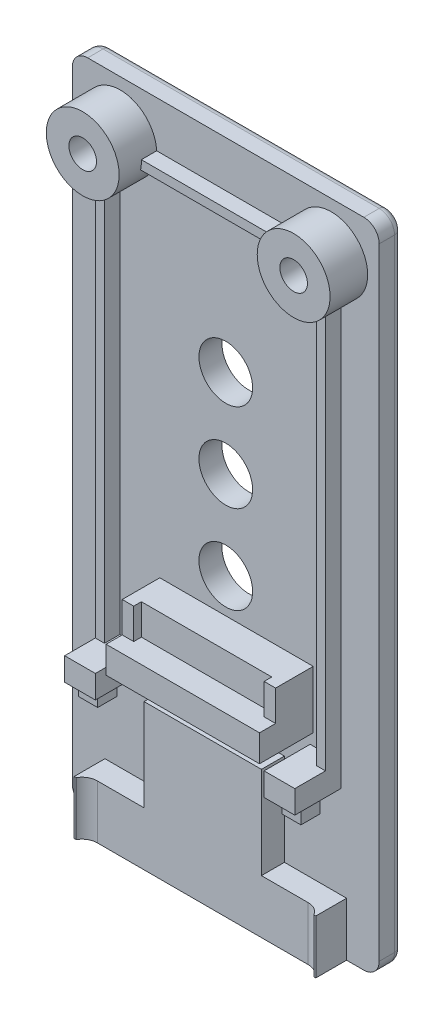
from build123d import *

# Parameters (mm, degrees)
EXTRUDE_1_DEPTH     = 3
SKETCH_4_W          = 31.5
SKETCH_4_H          = 7
EXTRUDE_2_DEPTH     = 3
SKETCH_5_W          = 15.3
SKETCH_5_H          = 12
EXTRUDE_3_DEPTH     = 3
EXTRUDE_3_2_DEPTH   = 2
SKETCH_7_W          = 4
SKETCH_7_H          = 3
EXTRUDE_5_DEPTH     = 6
SKETCH_8_W          = 2.5
SKETCH_8_H          = 2.5
EXTRUDE_6_DEPTH     = 2
EXTRUDE_7_DEPTH     = 7
SKETCH_10_W         = 38.86016461
SKETCH_10_H         = 9.384719245
CUT_EXTRUDE_1_DEPTH = 7
SKETCH_12_W         = 20
SKETCH_12_H         = 4
EXTRUDE_9_DEPTH     = 3.9
SKETCH_13_W         = 1.5
SKETCH_13_H         = 4
EXTRUDE_10_DEPTH    = 1
SKETCH_14_R         = 4.75
EXTRUDE_11_DEPTH    = 4.9
SKETCH_16_R         = 1.8
CUT_EXTRUDE_3_DEPTH = 87.322082101
SKETCH_17_R         = 3.5
CUT_EXTRUDE_4_DEPTH = 4
SKETCH_18_W         = 20
SKETCH_18_H         = 3.5
EXTRUDE_12_DEPTH    = 7
WRAP_START          = -0.4
WRAP_1_OUTLINE_W    = 0.897435898
WRAP_1_OUTLINE_H    = 3.5
WRAP_1_DEPTH        = 0.4
SKETCH_20_R         = 3.5
CUT_EXTRUDE_5_DEPTH = 7
WRAP1_START         = -0.4
WRAP1_DEPTH         = 0.4
FILLET1_R           = 1


# Read off the part's stored shape, not the designer's step: Перенос1, Wrap1
with BuildPart() as part:
    # Эскиз3 → Бобышка-Вытянуть1 (new body)
    with BuildSketch(Plane.XY):
        with BuildLine():
            Line((21.251874208, -81.291354299), (21.251874208, -0.291354299))
            ThreePointArc((21.251874208, -0.291354299), (20.66608777, 1.122859264), (19.251874208, 1.708645701))
            Line((19.251874208, 1.708645701), (-16.748125792, 1.708645701))
            ThreePointArc((-16.748125792, 1.708645701), (-18.162339355, 1.122859264), (-18.748125792, -0.291354299))
            Line((-18.748125792, -0.291354299), (-18.748125792, -81.291354299))
            ThreePointArc((-18.748125792, -81.291354299), (-18.162339355, -82.705567861), (-16.748125792, -83.291354299))
            Line((-16.748125792, -83.291354299), (-14.498125792, -83.291354299))
            Line((-14.498125792, -83.291354299), (19.251874208, -83.291354299))
            ThreePointArc((19.251874208, -83.291354299), (20.66608777, -82.705567861), (21.251874208, -81.291354299))
        make_face()
    extrude(amount=EXTRUDE_1_DEPTH)

    # Эскиз4 → Бобышка-Вытянуть2 (add)
    with BuildSketch(Plane.XY.offset(3)):
        with Locations((1.251874208, -79.791354299)):
            Rectangle(SKETCH_4_W, SKETCH_4_H)
    extrude(amount=EXTRUDE_2_DEPTH)

    # Эскиз5 → Extrude 3 (add)
    with BuildSketch(Plane.XY.offset(3)):
        with Locations((1.251874208, -70.291354299)):
            Rectangle(SKETCH_5_W, SKETCH_5_H)
    extrude(amount=EXTRUDE_3_DEPTH)

    # Эскиз6 → Extrude 3 2 (add)
    with BuildSketch(Plane.XY.offset(3)):
        Polygon((-13.748125792, -64.291354299), (-13.748125792, -4.291354299), (16.251874208, -4.291354299), (16.251874208, -64.291354299), (15.051874208, -64.291354299), (15.051874208, -5.491354299), (-12.548125792, -5.491354299), (-12.548125792, -64.291354299), align=None)
    extrude(amount=EXTRUDE_3_2_DEPTH)

    # Эскиз7 → Бобышка-Вытянуть5 (add)
    with BuildSketch(Plane.XY.offset(3)):
        with Locations((-11.748125792, -62.791354299)):
            Rectangle(SKETCH_7_W, SKETCH_7_H)
        with Locations((14.251874208, -62.791354299)):
            Rectangle(SKETCH_7_W, SKETCH_7_H)
    extrude(amount=EXTRUDE_5_DEPTH)

    # Эскиз8 → Бобышка-Вытянуть6 (add)
    with BuildSketch(Plane.XZ.offset(64.291354299)):
        with Locations((-11.998125792, 6.45)):
            Rectangle(SKETCH_8_W, SKETCH_8_H)
        with Locations((14.501874208, 6.45)):
            Rectangle(SKETCH_8_W, SKETCH_8_H)
    extrude(amount=EXTRUDE_6_DEPTH)

    # Эскиз9 → Бобышка-Вытянуть7 (add)
    with BuildSketch(Plane.XZ.offset(83.291354299)):
        with BuildLine():
            Line((-14.498125792, 6), (-14.498125792, 8))
            ThreePointArc((-14.498125792, 8), (-13.912339355, 6.585786438), (-12.498125792, 6))
            Line((-12.498125792, 6), (-14.498125792, 6))
        make_face()
        with BuildLine():
            Line((17.001874208, 6), (15.001874208, 6))
            ThreePointArc((15.001874208, 6), (16.41608777, 6.585786438), (17.001874208, 8))
            Line((17.001874208, 8), (17.001874208, 6))
        make_face()
    extrude(amount=-EXTRUDE_7_DEPTH)

    # Эскиз10 → Вырез-Вытянуть1 (cut)
    with BuildSketch(Plane.XZ.offset(83.291354299)):
        with Locations((0.85139178, 11.707560322)):
            Rectangle(SKETCH_10_W, SKETCH_10_H)
    extrude(amount=-CUT_EXTRUDE_1_DEPTH, mode=Mode.SUBTRACT)

    # Эскиз12 → Бобышка-Вытянуть9 (add)
    with BuildSketch(Plane.XY.offset(3)):
        with Locations((2.651874208, -54.291354299)):
            Rectangle(SKETCH_12_W, SKETCH_12_H)
    extrude(amount=EXTRUDE_9_DEPTH)

    # Эскиз13 → Бобышка-Вытянуть10 (add)
    with BuildSketch(Plane.XY.offset(6.9)):
        with Locations((11.901874208, -54.291354299)):
            Rectangle(SKETCH_13_W, SKETCH_13_H)
        with Locations((-6.598125792, -54.291354299)):
            Rectangle(SKETCH_13_W, SKETCH_13_H)
    extrude(amount=EXTRUDE_10_DEPTH)

    # Эскиз14 → Бобышка-Вытянуть11 (add)
    with BuildSketch(Plane.XY.offset(3)):
        with Locations(Location((-12.498125792, -4.541354299, 0), (0, 0, 254.74247671))):
            Circle(SKETCH_14_R)
        with Locations(Location((15.001874208, -4.541354299, 0), (0, 0, 180))):
            Circle(SKETCH_14_R)
    extrude(amount=EXTRUDE_11_DEPTH)

    # Эскиз16 → Вырез-Вытянуть3 (cut, through all)
    with BuildSketch(Plane.XY.offset(7.9)):
        with Locations((-12.498125792, -4.541354299)):
            Circle(SKETCH_16_R)
        with Locations((15.001874208, -4.541354299)):
            Circle(SKETCH_16_R)
    extrude(amount=-CUT_EXTRUDE_3_DEPTH, mode=Mode.SUBTRACT)

    # Эскиз17 → Вырез-Вытянуть4 (cut)
    with BuildSketch(Plane(origin=(0, 0, 0), x_dir=(-1, 0, 0), z_dir=(0, 0, -1))):
        with Locations((-15.001874208, -4.541354299)):
            Circle(SKETCH_17_R)
        with Locations((12.498125792, -4.541354299)):
            Circle(SKETCH_17_R)
    extrude(amount=-CUT_EXTRUDE_4_DEPTH, mode=Mode.SUBTRACT)

    # Эскиз18 → Бобышка-Вытянуть12 (add)
    with BuildSketch(Plane.XY.offset(3)):
        with Locations((2.651874208, -58.041354299)):
            Rectangle(SKETCH_18_W, SKETCH_18_H)
    extrude(amount=EXTRUDE_12_DEPTH)

    # Перенос1 outline → Перенос1 (cut)
    # profile 1 of 3: a face of its own
    with BuildSketch(Plane.XZ.offset(83.291354299).offset(WRAP_START)):
        with BuildLine():
            add(Edge.make_bspline(
                [(0.971762667, 1.5), (0.908191508, 1.50020437), (0.785468794, 1.500598903), (0.608264135, 1.505416294), (0.444649614, 1.513957561), (0.294722611, 1.524639346), (0.158664341, 1.53946478), (0.03645625, 1.556481913), (-0.071960628, 1.577306359), (-0.167999844, 1.601873952), (-0.25454211, 1.630907486), (-0.335693257, 1.662052171), (-0.411697516, 1.698473839), (-0.482982281, 1.738774368), (-0.549962864, 1.782246677), (-0.61248756, 1.829862159), (-0.670157432, 1.881932528), (-0.722835577, 1.937885814), (-0.769410157, 1.997608324), (-0.811736953, 2.059227105), (-0.845598189, 2.125095846), (-0.875009853, 2.192975425), (-0.896232828, 2.264437317), (-0.912960596, 2.338349293), (-0.921680049, 2.415458372), (-0.923268249, 2.467763964), (-0.924070667, 2.494190705)],
                knots=[0, 0, 0, 0, 0.07918369, 0.15286236, 0.220780569, 0.283251696, 0.340056682, 0.391229738, 0.43690319, 0.477502149, 0.514601086, 0.550550351, 0.585707068, 0.61946814, 0.652491974, 0.685097441, 0.717251441, 0.749173995, 0.780681042, 0.81152345, 0.842124493, 0.872780872, 0.903536606, 0.934827738, 0.967072537, 1, 1, 1, 1], degree=3))
            Line((0.971762667, 1.5), (1.947724205, 1.5))
            Line((1.947724205, 1.5), (1.947724205, 5))
            Line((1.947724205, 5), (1.050288308, 5))
            Line((1.050288308, 5), (1.050288308, 3.474358974))
            add(Edge.make_bspline(
                [(0.069418917, 3.421073718), (0.094152871, 3.425539616), (0.147848874, 3.435234827), (0.236162524, 3.445052875), (0.338085976, 3.454048862), (0.453788762, 3.461811102), (0.583310066, 3.467091734), (0.726583544, 3.471199744), (0.883876329, 3.474201348), (0.993262193, 3.474304959), (1.050288308, 3.474358974)],
                knots=[0, 0, 0, 0, 0.076652669, 0.166408568, 0.270908509, 0.388803477, 0.520106973, 0.666320705, 0.826043028, 1, 1, 1, 1], degree=3))
            add(Edge.make_bspline(
                [(-0.924070667, 2.494190705), (-0.923280696, 2.523447976), (-0.92172475, 2.581073787), (-0.908891016, 2.665504319), (-0.88754852, 2.745952319), (-0.859028443, 2.823199553), (-0.820708483, 2.896003671), (-0.774848335, 2.965653093), (-0.719856568, 3.030626699), (-0.656959752, 3.091877287), (-0.587118568, 3.148850029), (-0.511105436, 3.201910234), (-0.428452264, 3.249016356), (-0.341069552, 3.294000478), (-0.246446443, 3.331679235), (-0.146871093, 3.367282699), (-0.040973258, 3.397360113), (0.032162837, 3.413070651), (0.069418917, 3.421073718)],
                knots=[0, 0, 0, 0, 0.059226347, 0.116653609, 0.172442805, 0.227557458, 0.283016466, 0.338671005, 0.396115815, 0.455017933, 0.516221296, 0.578449912, 0.642494871, 0.708741953, 0.777293663, 0.848541795, 0.922846047, 1, 1, 1, 1], degree=3))
        make_face()
        with BuildLine():
            add(Edge.make_bspline(
                [(0.753713788, 2.846153846), (0.725668551, 2.845962385), (0.671678159, 2.845593799), (0.594071185, 2.844388739), (0.522994219, 2.841702152), (0.458741397, 2.837300055), (0.401160335, 2.832832713), (0.350477252, 2.826253381), (0.306154775, 2.819651451), (0.256859627, 2.80874307), (0.203011209, 2.791242699), (0.145400223, 2.764259758), (0.094231766, 2.732332582), (0.051288186, 2.693476578), (0.016530342, 2.650065849), (-0.008807584, 2.601886118), (-0.023978976, 2.549085389), (-0.025736895, 2.512285503), (-0.026634769, 2.493489583)],
                knots=[0, 0, 0, 0, 0.087984892, 0.169381301, 0.243490732, 0.31108677, 0.371426355, 0.424626274, 0.47139501, 0.511952633, 0.582901013, 0.648499292, 0.711142388, 0.771361583, 0.829301518, 0.884723481, 0.941121333, 1, 1, 1, 1], degree=3))
            Line((0.753713788, 2.846153846), (1.050288308, 2.846153846))
            Line((1.050288308, 2.846153846), (1.050288308, 2.128205128))
            Line((1.050288308, 2.128205128), (0.786666513, 2.128205128))
            add(Edge.make_bspline(
                [(0.193517474, 2.197616186), (0.208149718, 2.191964447), (0.239716749, 2.179771605), (0.292902747, 2.166277432), (0.354490829, 2.154546484), (0.424483924, 2.14495998), (0.502832613, 2.137348407), (0.589808451, 2.131642407), (0.685459838, 2.129351778), (0.752077595, 2.128597013), (0.786666513, 2.128205128)],
                knots=[0, 0, 0, 0, 0.078334475, 0.168995732, 0.273680162, 0.391619348, 0.521902516, 0.667035745, 0.82712007, 1, 1, 1, 1], degree=3))
            add(Edge.make_bspline(
                [(-0.026634769, 2.493489583), (-0.026024796, 2.477059925), (-0.024835011, 2.445012985), (-0.013698376, 2.399015888), (0.002792818, 2.355888178), (0.028346001, 2.317261279), (0.058989424, 2.280836435), (0.097965574, 2.24964819), (0.14221372, 2.219941175), (0.175937076, 2.205266351), (0.193517474, 2.197616186)],
                knots=[0, 0, 0, 0, 0.125011237, 0.243841194, 0.358954674, 0.475083597, 0.595069528, 0.720283665, 0.854180453, 1, 1, 1, 1], degree=3))
        make_face(mode=Mode.SUBTRACT)
    # profile 2 of 3: a face of its own
    with BuildSketch(Plane.XZ.offset(83.291354299).offset(WRAP_START)):
        with BuildLine():
            add(Edge.make_bspline(
                [(4.755716994, 2.397435897), (4.784020824, 2.368917647), (4.83898128, 2.31354083), (4.926267212, 2.240724486), (5.013362574, 2.178233035), (5.101216054, 2.127555756), (5.189405509, 2.087588075), (5.278117479, 2.059519577), (5.367317797, 2.041703865), (5.42707748, 2.039539452), (5.456838788, 2.038461538)],
                knots=[0, 0, 0, 0, 0.148821773, 0.288982531, 0.420667444, 0.545597723, 0.664221049, 0.778709881, 0.889793867, 1, 1, 1, 1], degree=3))
            Line((4.755716994, 2.397435897), (4.101570359, 1.967648237))
            add(Edge.make_bspline(
                [(5.458942154, 1.41025641), (5.400907286, 1.411745056), (5.286036532, 1.414691593), (5.11594271, 1.438068276), (4.949927807, 1.474943986), (4.814746874, 1.518906466), (4.70773641, 1.56294021), (4.625798064, 1.602237704), (4.542173628, 1.648133845), (4.456931276, 1.700044149), (4.369760715, 1.757573029), (4.281444991, 1.821557857), (4.19151339, 1.891847391), (4.132027095, 1.941980363), (4.101570359, 1.967648237)],
                knots=[0, 0, 0, 0, 0.115818089, 0.229243415, 0.342091558, 0.454958989, 0.51248856, 0.573005292, 0.636267093, 0.702838359, 0.77219596, 0.844709553, 0.920491934, 1, 1, 1, 1], degree=3))
            add(Edge.make_bspline(
                [(6.749006256, 2.297876603), (6.748012767, 2.267873023), (6.746046973, 2.208505664), (6.727694994, 2.121181657), (6.698086828, 2.037316444), (6.656921709, 1.95679612), (6.604350228, 1.87941019), (6.539354927, 1.805996884), (6.462881868, 1.735800188), (6.376813617, 1.669051774), (6.281709047, 1.608405989), (6.180128293, 1.555209661), (6.073173961, 1.510193262), (5.960783914, 1.473664146), (5.84314776, 1.444971013), (5.719869145, 1.424727658), (5.591225688, 1.412746232), (5.50360589, 1.411097065), (5.458942154, 1.41025641)],
                knots=[0, 0, 0, 0, 0.052011694, 0.102914283, 0.154092384, 0.205964756, 0.259394338, 0.316010344, 0.37570202, 0.439299716, 0.504774385, 0.571167027, 0.638052053, 0.705895375, 0.776027396, 0.847966533, 0.922501732, 1, 1, 1, 1], degree=3))
            add(Edge.make_bspline(
                [(5.543777891, 3.526241987), (5.60439235, 3.48851699), (5.720704905, 3.416126824), (5.886256433, 3.310111252), (6.034485916, 3.209506282), (6.166165666, 3.11616137), (6.280730119, 3.029150904), (6.378696712, 2.949437684), (6.459933469, 2.876160678), (6.525106866, 2.807540063), (6.578616938, 2.742365612), (6.624269147, 2.679139463), (6.662220455, 2.615339751), (6.694622194, 2.552310878), (6.717956708, 2.488245812), (6.735985284, 2.424855381), (6.746935779, 2.361357029), (6.7483189, 2.318950812), (6.749006256, 2.297876603)],
                knots=[0, 0, 0, 0, 0.11978186, 0.229848361, 0.329790464, 0.42031278, 0.50061585, 0.571102614, 0.632161366, 0.684026302, 0.729711759, 0.773559908, 0.814713146, 0.854167012, 0.892256842, 0.9288816, 0.964656973, 1, 1, 1, 1], degree=3))
            add(Edge.make_bspline(
                [(4.909262667, 4.129907853), (4.91056527, 4.109830378), (4.913250194, 4.068446709), (4.938084095, 4.00792313), (4.975211065, 3.947607146), (5.018015607, 3.898447458), (5.062089064, 3.857494228), (5.105084077, 3.821903128), (5.156782244, 3.782174088), (5.217384071, 3.738853185), (5.286234974, 3.691025697), (5.363935153, 3.639150506), (5.451006373, 3.584078399), (5.511971488, 3.546071006), (5.543777891, 3.526241987)],
                knots=[0, 0, 0, 0, 0.066195889, 0.136442901, 0.213511942, 0.300171859, 0.351060516, 0.41255759, 0.484802944, 0.566802284, 0.659059242, 0.762240449, 0.875957324, 1, 1, 1, 1], degree=3))
            add(Edge.make_bspline(
                [(5.44982757, 4.461538462), (5.413034137, 4.460468214), (5.342191989, 4.458407558), (5.240659523, 4.438672564), (5.147446181, 4.408544433), (5.066140737, 4.364538339), (4.997741887, 4.31411116), (4.947845553, 4.257117088), (4.91496208, 4.195448702), (4.911143812, 4.151540233), (4.909262667, 4.129907853)],
                knots=[0, 0, 0, 0, 0.158963156, 0.306067973, 0.445758512, 0.580973863, 0.704301054, 0.811092378, 0.906930901, 1, 1, 1, 1], degree=3))
            add(Edge.make_bspline(
                [(6.225969397, 4.012820513), (6.197854741, 4.04841865), (6.143399878, 4.117368154), (6.05381237, 4.208831091), (5.96171916, 4.286953288), (5.865809055, 4.350710241), (5.766411792, 4.40026297), (5.66370944, 4.435682506), (5.557790315, 4.457547331), (5.485920689, 4.460204183), (5.44982757, 4.461538462)],
                knots=[0, 0, 0, 0, 0.146075656, 0.282931775, 0.411745189, 0.534552627, 0.653095629, 0.768595453, 0.883788015, 1, 1, 1, 1], degree=3))
            Line((6.225969397, 4.012820513), (6.973365231, 4.344451122))
            add(Edge.make_bspline(
                [(5.45753991, 5.08974359), (5.498687034, 5.089218522), (5.579900301, 5.088182181), (5.699708282, 5.079570616), (5.815566862, 5.065712744), (5.927211308, 5.046055121), (6.035037302, 5.021019175), (6.138547069, 4.98918074), (6.238453059, 4.952923366), (6.334380442, 4.910760567), (6.426181453, 4.862069902), (6.515217248, 4.808245508), (6.599950753, 4.746591106), (6.68242712, 4.67974375), (6.759844452, 4.604621831), (6.8354598, 4.524772741), (6.906992516, 4.437737833), (6.951057907, 4.375804019), (6.973365231, 4.344451122)],
                knots=[0, 0, 0, 0, 0.069915746, 0.137994726, 0.204003451, 0.268121317, 0.330544027, 0.391978547, 0.452035638, 0.511070292, 0.569872046, 0.628516675, 0.687703422, 0.747809079, 0.808764198, 0.870857566, 0.934623929, 1, 1, 1, 1], degree=3))
            add(Edge.make_bspline(
                [(4.011826769, 4.093449519), (4.01296345, 4.128837277), (4.015201053, 4.198499564), (4.035231705, 4.300354161), (4.065366309, 4.397940328), (4.110777409, 4.489793317), (4.167252507, 4.577463939), (4.236268616, 4.660536772), (4.318796338, 4.737832255), (4.412160445, 4.810218734), (4.515891257, 4.875975209), (4.628107211, 4.933398665), (4.748131513, 4.981695294), (4.875238225, 5.022131569), (5.010387482, 5.051347471), (5.152609562, 5.074241056), (5.302570467, 5.087557759), (5.405163627, 5.089004827), (5.45753991, 5.08974359)],
                knots=[0, 0, 0, 0, 0.054294377, 0.106880761, 0.158869658, 0.210720843, 0.263686811, 0.318742268, 0.376121444, 0.437004001, 0.4999343, 0.5644656, 0.630317964, 0.698429304, 0.769050697, 0.842458362, 0.919571194, 1, 1, 1, 1], degree=3))
            add(Edge.make_bspline(
                [(4.506818756, 3.290665064), (4.464720953, 3.323956355), (4.384615198, 3.387304649), (4.278423345, 3.486570299), (4.191747507, 3.583776261), (4.122938613, 3.679554226), (4.072935269, 3.777923067), (4.03748061, 3.87926368), (4.015797748, 3.985024873), (4.013157143, 4.057124645), (4.011826769, 4.093449519)],
                knots=[0, 0, 0, 0, 0.164016378, 0.312098367, 0.443688691, 0.561619719, 0.671529106, 0.779753886, 0.889036923, 1, 1, 1, 1], degree=3))
            add(Edge.make_bspline(
                [(5.12170257, 2.88681891), (5.081503575, 2.912290775), (5.005269385, 2.960596134), (4.897077443, 3.029198518), (4.801574642, 3.091033297), (4.718745124, 3.145461321), (4.647970082, 3.191914187), (4.589811314, 3.231228069), (4.543693029, 3.262836045), (4.517751472, 3.282414142), (4.506818756, 3.290665064)],
                knots=[0, 0, 0, 0, 0.194038191, 0.367977956, 0.522335656, 0.657918667, 0.772091586, 0.867500417, 0.944159856, 1, 1, 1, 1], degree=3))
            add(Edge.make_bspline(
                [(5.772343596, 2.435296474), (5.761240769, 2.445480397), (5.735177711, 2.469386394), (5.687245034, 2.506548982), (5.626000349, 2.551330889), (5.55152297, 2.604055729), (5.463169488, 2.664005245), (5.361693772, 2.732071014), (5.246343431, 2.807136279), (5.164743894, 2.859302686), (5.12170257, 2.88681891)],
                knots=[0, 0, 0, 0, 0.057002562, 0.133809257, 0.229342778, 0.344199144, 0.479135899, 0.633445493, 0.806653426, 1, 1, 1, 1], degree=3))
            add(Edge.make_bspline(
                [(5.851570359, 2.267728365), (5.850590763, 2.282334722), (5.848598291, 2.312043645), (5.83293809, 2.355699045), (5.807094623, 2.397454354), (5.784246657, 2.42233464), (5.772343596, 2.435296474)],
                knots=[0, 0, 0, 0, 0.230074692, 0.467965513, 0.722827033, 1, 1, 1, 1], degree=3))
            add(Edge.make_bspline(
                [(5.456838788, 2.038461538), (5.484482683, 2.039116881), (5.537552779, 2.040374991), (5.613164552, 2.054123697), (5.681388546, 2.075205471), (5.740026111, 2.106134474), (5.788074924, 2.141958019), (5.824932005, 2.180443988), (5.847023465, 2.223403254), (5.850086163, 2.253259773), (5.851570359, 2.267728365)],
                knots=[0, 0, 0, 0, 0.166219856, 0.319104949, 0.461027066, 0.594430909, 0.715980947, 0.820550761, 0.913038162, 1, 1, 1, 1], degree=3))
        make_face()
    # profile 3 of 3: a face of its own
    with BuildSketch(Plane.XZ.offset(83.291354299).offset(WRAP_START)):
        with Locations((-3.34714759, 3.25)):
            Rectangle(WRAP_1_OUTLINE_W, WRAP_1_OUTLINE_H)
    extrude(amount=WRAP_1_DEPTH, mode=Mode.SUBTRACT)

    # Эскиз20 → Вырез-Вытянуть5 (cut)
    with BuildSketch(Plane.XY.offset(3)):
        with Locations((1.251874208, -47.791354299)):
            Circle(SKETCH_20_R)
        with Locations((1.251874208, -36.291354299)):
            Circle(SKETCH_20_R)
        with Locations((1.251874208, -24.791354299)):
            Circle(SKETCH_20_R)
    extrude(amount=-CUT_EXTRUDE_5_DEPTH, mode=Mode.SUBTRACT)

    # Wrap1 outline → Wrap1 (cut)
    with BuildSketch(Plane(origin=(0, 0, 0), x_dir=(-1, 0, 0), z_dir=(0, 0, -1)).offset(WRAP1_START)):
        with BuildLine():
            add(Edge.make_bspline(
                [(-3.781922284, -55.573405581), (-3.810668205, -55.532856471), (-3.865856364, -55.455007836), (-3.955310613, -55.350766678), (-4.04436093, -55.261841213), (-4.133832313, -55.188602931), (-4.224517801, -55.131496807), (-4.316259977, -55.091065041), (-4.408538731, -55.065362183), (-4.470535809, -55.062161559), (-4.501072925, -55.060585068)],
                knots=[0, 0, 0, 0, 0.162420307, 0.31182434, 0.448432767, 0.573381197, 0.689077147, 0.797572901, 0.900293043, 1, 1, 1, 1], degree=3))
            Line((-3.781922284, -55.573405581), (-3.110848567, -54.959423209))
            add(Edge.make_bspline(
                [(-4.4910569, -54.163149171), (-4.432145639, -54.16530427), (-4.314788142, -54.169597457), (-4.141271698, -54.203168779), (-3.97178809, -54.255963218), (-3.835215023, -54.319653901), (-3.726546382, -54.381351095), (-3.64326202, -54.4381541), (-3.558515699, -54.503224995), (-3.471623992, -54.576768836), (-3.384201482, -54.660171285), (-3.293762329, -54.751446881), (-3.201538876, -54.85138446), (-3.141608254, -54.922779402), (-3.110848567, -54.959423209)],
                knots=[0, 0, 0, 0, 0.10691022, 0.212976528, 0.319776676, 0.428556273, 0.485856803, 0.546558687, 0.611431498, 0.67982091, 0.753158505, 0.830752869, 0.913133075, 1, 1, 1, 1], degree=3))
            add(Edge.make_bspline(
                [(-5.803156259, -55.431178017), (-5.802071695, -55.388370699), (-5.799934989, -55.304035685), (-5.780875235, -55.180033335), (-5.752389708, -55.060381486), (-5.711020544, -54.945516682), (-5.657328364, -54.835582798), (-5.592121298, -54.730041659), (-5.514386802, -54.629864643), (-5.426785274, -54.535118161), (-5.330270817, -54.448530657), (-5.227132856, -54.37210851), (-5.117955159, -54.307561253), (-5.00340562, -54.254014616), (-4.882774424, -54.213028067), (-4.756950255, -54.183974758), (-4.625752641, -54.166694777), (-4.536514856, -54.164345764), (-4.4910569, -54.163149171)],
                knots=[0, 0, 0, 0, 0.06317288, 0.12445736, 0.184840915, 0.244566821, 0.304319173, 0.365199786, 0.427420983, 0.491261689, 0.555499002, 0.618604518, 0.680494764, 0.742473305, 0.804990665, 0.868251971, 0.932887217, 1, 1, 1, 1], degree=3))
            add(Edge.make_bspline(
                [(-4.543140233, -57.185985709), (-4.606781785, -57.132138853), (-4.728929186, -57.028790439), (-4.901538961, -56.876148084), (-5.057075824, -56.733489818), (-5.19419639, -56.59905207), (-5.314647789, -56.475317597), (-5.417614271, -56.361281377), (-5.501964703, -56.256063779), (-5.590725344, -56.131440576), (-5.675065699, -55.979578639), (-5.7479597, -55.796871124), (-5.795250251, -55.614186792), (-5.8005485, -55.491542593), (-5.803156259, -55.431178017)],
                knots=[0, 0, 0, 0, 0.112124581, 0.215201009, 0.309902452, 0.395959096, 0.473447494, 0.542140328, 0.602523333, 0.654726333, 0.747804055, 0.835278417, 0.918925243, 1, 1, 1, 1], degree=3))
            add(Edge.make_bspline(
                [(-3.880079336, -58.048365517), (-3.881725679, -58.019834426), (-3.885070068, -57.961876247), (-3.909703805, -57.875701755), (-3.948213849, -57.789566454), (-3.993773947, -57.718915949), (-4.040137052, -57.659762196), (-4.084470638, -57.608508145), (-4.138457217, -57.551881392), (-4.201959904, -57.489810705), (-4.274139663, -57.421749659), (-4.355057295, -57.347704919), (-4.445639394, -57.268328731), (-4.509663, -57.214258456), (-4.543140233, -57.185985709)],
                knots=[0, 0, 0, 0, 0.076346606, 0.155090822, 0.238351561, 0.32840414, 0.37938386, 0.439617644, 0.509831416, 0.588874645, 0.677436354, 0.77554672, 0.882635872, 1, 1, 1, 1], degree=3))
            add(Edge.make_bspline(
                [(-4.450992797, -58.52212353), (-4.412079925, -58.520549793), (-4.336583284, -58.517496515), (-4.228821491, -58.489294305), (-4.130021398, -58.445014766), (-4.044619328, -58.38183397), (-3.972306239, -58.308913728), (-3.918935029, -58.227786625), (-3.885406875, -58.140009059), (-3.881862136, -58.079032987), (-3.880079336, -58.048365517)],
                knots=[0, 0, 0, 0, 0.141985893, 0.275473311, 0.404345843, 0.535429711, 0.661427401, 0.77786684, 0.888279749, 1, 1, 1, 1], degree=3))
            add(Edge.make_bspline(
                [(-5.270303695, -57.881097888), (-5.241162537, -57.931752194), (-5.185296446, -58.028860827), (-5.090626133, -58.159338582), (-4.99364123, -58.271071182), (-4.892099534, -58.362083745), (-4.787235753, -58.433593226), (-4.67854337, -58.484698862), (-4.565946022, -58.516333193), (-4.489249823, -58.520196476), (-4.450992797, -58.52212353)],
                knots=[0, 0, 0, 0, 0.160457921, 0.307611547, 0.442138888, 0.566229194, 0.681222208, 0.789558005, 0.895028892, 1, 1, 1, 1], degree=3))
            Line((-5.270303695, -57.881097888), (-6.059566515, -58.354855901))
            add(Edge.make_bspline(
                [(-4.484045682, -59.419559427), (-4.526808907, -59.418800779), (-4.611504618, -59.417298221), (-4.736333292, -59.405031082), (-4.856869487, -59.385233227), (-4.972977431, -59.356856985), (-5.085180211, -59.320900438), (-5.193482433, -59.276980894), (-5.297136453, -59.224417616), (-5.396926566, -59.164291513), (-5.492367668, -59.094477188), (-5.584666575, -59.016401972), (-5.672906487, -58.928865032), (-5.757511201, -58.83207339), (-5.837939394, -58.725752956), (-5.916823768, -58.611384438), (-5.990658464, -58.486845313), (-6.036269441, -58.399480108), (-6.059566515, -58.354855901)],
                knots=[0, 0, 0, 0, 0.063551482, 0.125868382, 0.18624025, 0.244976651, 0.303357688, 0.361230317, 0.418489049, 0.475936712, 0.534203744, 0.594059429, 0.655468694, 0.718771685, 0.784974607, 0.853522316, 0.925182451, 1, 1, 1, 1], degree=3))
            add(Edge.make_bspline(
                [(-2.982643438, -57.996282183), (-2.983538446, -58.046779928), (-2.985294484, -58.145858383), (-3.00680258, -58.290844944), (-3.037471864, -58.429603375), (-3.084891956, -58.560623788), (-3.142687284, -58.686056844), (-3.215142075, -58.803948695), (-3.300230292, -58.915492453), (-3.397754453, -59.018694139), (-3.505627756, -59.112342516), (-3.621332125, -59.195710513), (-3.745998977, -59.264541413), (-3.878563176, -59.32121875), (-4.018953765, -59.364872393), (-4.167003497, -59.397136504), (-4.322938822, -59.416500914), (-4.429569645, -59.418525233), (-4.484045682, -59.419559427)],
                knots=[0, 0, 0, 0, 0.065200875, 0.127926544, 0.18904691, 0.248543693, 0.307607127, 0.36724766, 0.426963056, 0.488617128, 0.550391855, 0.611330734, 0.672556085, 0.734024191, 0.797340621, 0.862249627, 0.929625466, 1, 1, 1, 1], degree=3))
            add(Edge.make_bspline(
                [(-3.499470361, -56.849447247), (-3.455328098, -56.89721863), (-3.370471165, -56.989052005), (-3.260187067, -57.131364855), (-3.169419687, -57.270291215), (-3.09920032, -57.408445209), (-3.04616783, -57.547820125), (-3.008779222, -57.691834125), (-2.986386936, -57.841992065), (-2.98390087, -57.944456528), (-2.982643438, -57.996282183)],
                knots=[0, 0, 0, 0, 0.150833097, 0.289954183, 0.417138648, 0.535255184, 0.648751095, 0.762405462, 0.879826701, 1, 1, 1, 1], degree=3))
            add(Edge.make_bspline(
                [(-4.14350081, -56.272524171), (-4.101441309, -56.308924547), (-4.021621115, -56.378004899), (-3.90805283, -56.476053367), (-3.808245222, -56.564265182), (-3.720744322, -56.641316476), (-3.646876558, -56.708015691), (-3.58633139, -56.764681649), (-3.538369361, -56.810211168), (-3.511105757, -56.837711026), (-3.499470361, -56.849447247)],
                knots=[0, 0, 0, 0, 0.192952702, 0.366184141, 0.520457298, 0.655012135, 0.770624226, 0.865677185, 0.942674527, 1, 1, 1, 1], degree=3))
            add(Edge.make_bspline(
                [(-4.822587349, -55.627492119), (-4.811088473, -55.642008907), (-4.784619581, -55.675424636), (-4.734148826, -55.728349942), (-4.670768156, -55.793188075), (-4.592038551, -55.86770944), (-4.501228293, -55.954594119), (-4.394128209, -56.05042664), (-4.273821107, -56.158174826), (-4.188309606, -56.233206761), (-4.14350081, -56.272524171)],
                knots=[0, 0, 0, 0, 0.059234189, 0.136349281, 0.233805212, 0.349411224, 0.48317915, 0.635966856, 0.809243356, 1, 1, 1, 1], degree=3))
            add(Edge.make_bspline(
                [(-4.905720361, -55.388109106), (-4.90483708, -55.408920517), (-4.903058273, -55.450831806), (-4.885877425, -55.51225802), (-4.859980981, -55.572278582), (-4.835235871, -55.608815954), (-4.822587349, -55.627492119)],
                knots=[0, 0, 0, 0, 0.241881375, 0.487115475, 0.73783784, 1, 1, 1, 1], degree=3))
            add(Edge.make_bspline(
                [(-4.501072925, -55.060585068), (-4.529557072, -55.061584005), (-4.584552475, -55.06351269), (-4.662952503, -55.082683674), (-4.732557164, -55.115769977), (-4.793298527, -55.159033102), (-4.841414648, -55.211155138), (-4.87983164, -55.265817752), (-4.901463634, -55.326152915), (-4.90431083, -55.367593539), (-4.905720361, -55.388109106)],
                knots=[0, 0, 0, 0, 0.148126258, 0.285992887, 0.416634394, 0.547379946, 0.671582838, 0.784400739, 0.893265576, 1, 1, 1, 1], degree=3))
        make_face()
        Polygon((6.498125792, -38.791354299), (8.998125792, -33.791354299), (3.998125792, -33.791354299), align=None)
        Polygon((6.498125792, -22.291354299), (3.998125792, -27.291354299), (8.998125792, -27.291354299), align=None)
        Polygon((2.786587331, -55.188790196), (3.684023228, -55.188790196), (3.684023228, -54.291354299), (0.991715536, -54.291354299), (0.991715536, -55.188790196), (1.889151433, -55.188790196), (1.889151433, -59.291354299), (2.786587331, -59.291354299), align=None)
        Polygon((-1.187771643, -56.150328658), (-1.187771643, -55.188790196), (0.607100151, -55.188790196), (0.607100151, -54.291354299), (-2.085207541, -54.291354299), (-2.085207541, -59.291354299), (0.607100151, -59.291354299), (0.607100151, -58.393918401), (-1.187771643, -58.393918401), (-1.187771643, -57.047764555), (0.607100151, -57.047764555), (0.607100151, -56.150328658), align=None)
    extrude(amount=WRAP1_DEPTH, mode=Mode.SUBTRACT)

    # Fillet1
    fillet1_edges = [part.edges().sort_by_distance(p)[0] for p in [
        (-18.162339355, -82.705567861, 0),
        (-18.748125792, -40.791354299, 0),
        (-18.162339355, 1.122859264, 0),
        (1.251874208, 1.708645701, 0),
        (20.66608777, 1.122859264, 0),
        (21.251874208, -40.791354299, 0),
        (20.66608777, -82.705567861, 0),
        (1.251874208, -83.291354299, 0),
    ]]
    fillet(fillet1_edges, radius=FILLET1_R)


solid = part.part
